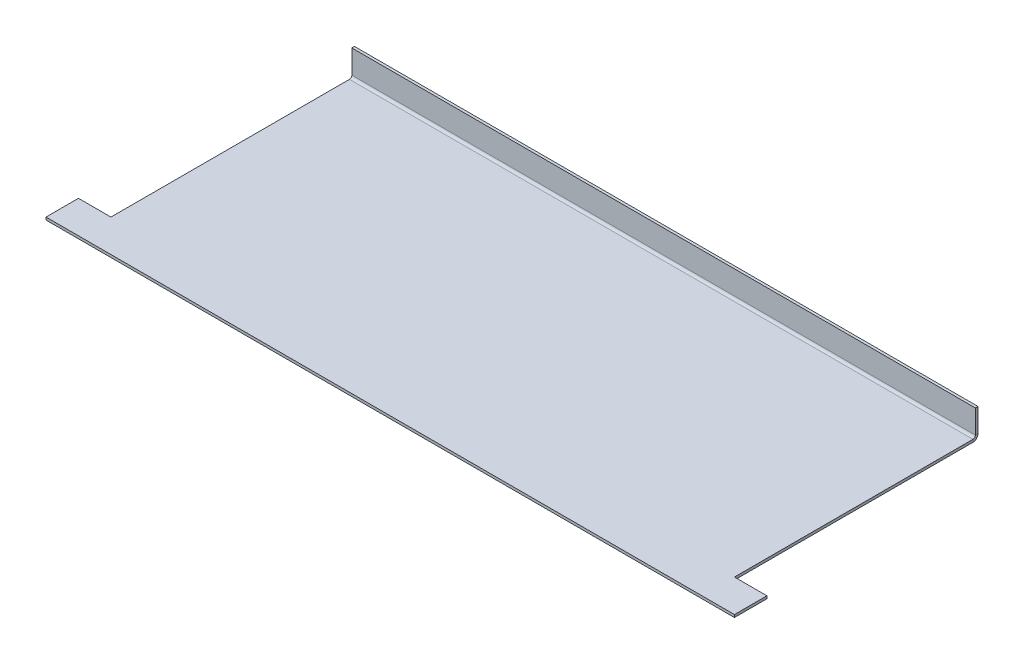
from build123d import *

# Parameters (mm, degrees)
SKETCH1_W                    = 212
SKETCH1_H                    = 85
BASE_FLANGE1_DEPTH           = 0.81
CUT_EXTRUDE1_REACH           = 230.407
SKETCH6_W                    = 10
SKETCH6_H                    = 75
EDGE_FLANGE1_STRIP_W         = 4.7132
EDGE_FLANGE1_STRIP_H         = 0.81
EDGE_FLANGE1_STRIP_CUT_DEPTH = 192
EDGE_FLANGE1_DEPTH           = 192


# Sheet-metal steps are written as plain solids
with BuildPart() as part:
    # Sketch1 → Base-Flange1 (new body)
    with BuildSketch(Plane(origin=(0, 0, 0), x_dir=(1, 0, 0), z_dir=(0, 1, 0))):
        with Locations((106, 42.5)):
            Rectangle(SKETCH1_W, SKETCH1_H)
    extrude(amount=-BASE_FLANGE1_DEPTH)

    # Sketch6 → Cut-Extrude1 (cut, up to next)
    with BuildSketch(Plane(origin=(0, 0, 0), x_dir=(1, 0, 0), z_dir=(0, 1, 0)), mode=Mode.PRIVATE) as cut_extrude1_sk1:
        with Locations((5, 47.5)):
            Rectangle(SKETCH6_W, SKETCH6_H)
    cut_extrude1_tool1 = extrude(cut_extrude1_sk1.sketch, amount=-CUT_EXTRUDE1_REACH, mode=Mode.PRIVATE) & part.part
    # Sketch6 → Cut-Extrude1 (cut, up to next)
    with BuildSketch(Plane(origin=(0, 0, 0), x_dir=(1, 0, 0), z_dir=(0, 1, 0)), mode=Mode.PRIVATE) as cut_extrude1_sk2:
        with Locations((207, 47.5)):
            Rectangle(SKETCH6_W, SKETCH6_H)
    cut_extrude1_tool2 = extrude(cut_extrude1_sk2.sketch, amount=-CUT_EXTRUDE1_REACH, mode=Mode.PRIVATE) & part.part
    add(cut_extrude1_tool1.solids().sort_by_distance((5, 0, -47.5))[0], mode=Mode.SUBTRACT)
    add(cut_extrude1_tool2.solids().sort_by_distance((207, 0, -47.5))[0], mode=Mode.SUBTRACT)

    # Edge-Flange1 strip (across the edge) → Edge-Flange1 strip cut (cut)
    with BuildSketch(Plane(origin=(202, 0, -85), x_dir=(0, 0, 1), z_dir=(-1, 0, 0))):
        with Locations((-0.81, -0.405)):
            Rectangle(EDGE_FLANGE1_STRIP_W, EDGE_FLANGE1_STRIP_H)
    extrude(amount=EDGE_FLANGE1_STRIP_CUT_DEPTH, mode=Mode.SUBTRACT)

    # Edge-Flange1 section (across the edge) → Edge-Flange1 (add)
    with BuildSketch(Plane(origin=(202, 0, -85), x_dir=(0, 0, 1), z_dir=(-1, 0, 0))):
        with BuildLine():
            Line((0, 0.7366), (0, 8))
            Line((0, 8), (0.81, 8))
            Line((0.81, 8), (0.81, 0.7366))
            ThreePointArc((0.81, 0.7366), (1.025745145, 0.215745145), (1.5466, 0))
            Line((1.5466, 0), (1.5466, -0.81))
            ThreePointArc((1.5466, -0.81), (0.452988652, -0.357011348), (0, 0.7366))
        make_face()
    extrude(amount=EDGE_FLANGE1_DEPTH)


solid = part.part
